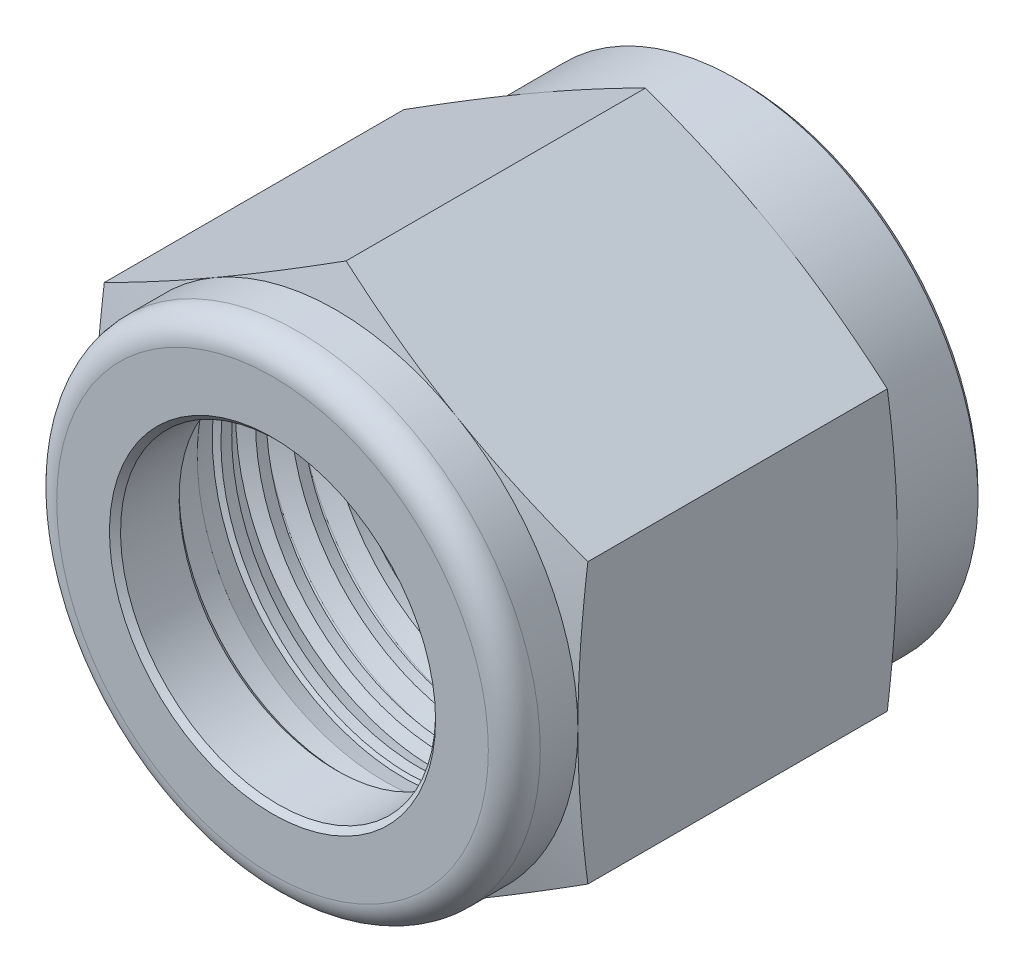
from build123d import *

# Parameters (mm, degrees)
BOSS_EXTRUDE1_DEPTH = 21.5646
FILLET1_R           = 1.1938
CHAMFER1_SIZE       = 0.254
CHAMFER2_SIZE       = 0.254
CUT_SWEEP1_PITCH    = 1.5875


with BuildPart() as part:
    # Sketch1 → Boss-Extrude1 (new body)
    with BuildSketch(Plane.XY):
        Polygon((0, 12.831609733), (-11.1125, 6.415804866), (-11.1125, -6.415804866), (0, -12.831609733), (11.1125, -6.415804866), (11.1125, 6.415804866), align=None)
    extrude(amount=BOSS_EXTRUDE1_DEPTH)

    # Sketch2 → Cut-Revolve1 (revolve, cut)
    with BuildSketch(Plane(origin=(0, 0, 0), x_dir=(0, 0, -1), z_dir=(1, 0, 0))):
        Polygon((-21.5646, 14.550719465), (-21.5646, 11.1125), (-18.6436, 11.1125), (-18.182965935, 12.831609733), (-4.423034065, 12.831609733), (-3.9624, 11.1125), (0, 11.1125), (0, 14.550719465), align=None)
        with BuildLine():
            Line((-21.5646, 7.239), (-21.5646, 0))
            Line((-21.5646, 0), (0, 0))
            Line((0, 0), (0, 8.751666378))
            Line((0, 8.751666378), (-18.1102, 8.751666378))
            ThreePointArc((-18.1102, 8.751666378), (-18.289805122, 8.6772715), (-18.3642, 8.497666378))
            Line((-18.3642, 8.497666378), (-18.3642, 7.239))
            Line((-18.3642, 7.239), (-21.5646, 7.239))
        make_face()
    revolve(axis=Axis((0, 0, 0), (0, 0, 1)), mode=Mode.SUBTRACT)

    # Fillet1
    fillet1_edges = [part.edges().sort_by_distance(p)[0] for p in [
        (0, -11.1125, 21.5646),
    ]]
    fillet(fillet1_edges, radius=FILLET1_R)

    # Chamfer1
    chamfer1_edges = [part.edges().sort_by_distance(p)[0] for p in [
        (0, -11.1125, 0),
    ]]
    chamfer(chamfer1_edges, length=CHAMFER1_SIZE)

    # Chamfer2
    chamfer2_edges = [part.edges().sort_by_distance(p)[0] for p in [
        (0, -7.239, 21.5646),
        (0, -7.239, 18.3642),
    ]]
    chamfer(chamfer2_edges, length=CHAMFER2_SIZE)

    # Cut-Sweep1: the profile of Sketch4 screwed along a right-hand helix of 11.352 turns, 8 arcs to a turn; built about Z, then put on its axis
    cut_sweep1_z = Axis((0, 0, 0), (0, 0, 1))
    cut_sweep1_corners = [(9.525, 0, -0.446484375), (8.536851483, 0, 0.124023437), (8.536851483, 0, -1.215429687), (9.525, 0, -0.644921875), (9.582283972, 0, -0.545703125)]
    with BuildLine(mode=Mode.PRIVATE) as cut_sweep1_profile:
        Line(cut_sweep1_corners[0], cut_sweep1_corners[1])
        Line(cut_sweep1_corners[1], cut_sweep1_corners[2])
        Line(cut_sweep1_corners[2], cut_sweep1_corners[3])
        ThreePointArc((9.525, 0, -0.644921875), (9.566934778, 0, -0.602987097), (9.582283972, 0, -0.545703125))
        ThreePointArc((9.582283972, 0, -0.545703125), (9.566934778, 0, -0.488419153), (9.525, 0, -0.446484375))
    cut_sweep1_cap = Face(cut_sweep1_profile.wire())
    cut_sweep1_arcs = [((9.525, 0, -0.644921875), (9.582283972, 0, -0.611848958), (9.582283972, 0, -0.545703125), (1, 0.8660254037844388, 1)), ((9.582283972, 0, -0.545703125), (9.582283972, 0, -0.479557292), (9.525, 0, -0.446484375), (1, 0.8660254037844388, 1))]  # start, shoulder, end, weights
    cut_sweep1_turn_angles = [0, 22.5, 45, 67.5, 90, 112.5, 135, 157.5, 180, 202.5, 225, 247.5, 270, 292.5, 315, 337.5, 360]
    cut_sweep1_turn_weights = [1, 0.9238795325112867, 1, 0.9238795325112867, 1, 0.9238795325112867, 1, 0.9238795325112867, 1, 0.9238795325112867, 1, 0.9238795325112867, 1, 0.9238795325112867, 1, 0.9238795325112867, 1]
    cut_sweep1_turn_rails = [Edge.make_bspline([Vector(p[0], p[1], 0).rotate(cut_sweep1_z, cut_sweep1_turn_angles[k]) / cut_sweep1_turn_weights[k] + Vector(0, 0, p[2] + CUT_SWEEP1_PITCH * cut_sweep1_turn_angles[k] / 360) for k in range(17)], [0, 0, 0, 1, 1, 2, 2, 3, 3, 4, 4, 5, 5, 6, 6, 7, 7, 8, 8, 8], 2, cut_sweep1_turn_weights) for p in cut_sweep1_corners]
    cut_sweep1_turn_sides = [*[Face.make_surface_from_curves(cut_sweep1_turn_rails[p[0]], cut_sweep1_turn_rails[p[1]]) for p in [(0, 1), (1, 2), (2, 3)]], *[Face.make_bezier_surface([[Vector(p[j][0], p[j][1], 0).rotate(cut_sweep1_z, cut_sweep1_turn_angles[2 * i + k]) / cut_sweep1_turn_weights[2 * i + k] + Vector(0, 0, p[j][2] + CUT_SWEEP1_PITCH * cut_sweep1_turn_angles[2 * i + k] / 360) for k in range(3)] for j in range(3)], [[p[3][j] * cut_sweep1_turn_weights[2 * i + k] for k in range(3)] for j in range(3)]) for p in cut_sweep1_arcs for i in range(8)]]
    cut_sweep1_last_angles = [3960, 3982.5, 4005, 4027.5, 4050, 4068.36, 4086.72]
    cut_sweep1_last_weights = [1, 0.9238795325112867, 1, 0.9238795325112867, 1, 0.9490961449902189, 1]
    cut_sweep1_last_rails = [Edge.make_bspline([Vector(p[0], p[1], 0).rotate(cut_sweep1_z, cut_sweep1_last_angles[k]) / cut_sweep1_last_weights[k] + Vector(0, 0, p[2] + CUT_SWEEP1_PITCH * cut_sweep1_last_angles[k] / 360) for k in range(7)], [0, 0, 0, 1, 1, 2, 2, 3, 3, 3], 2, cut_sweep1_last_weights) for p in cut_sweep1_corners]
    cut_sweep1_last_sides = [*[Face.make_surface_from_curves(cut_sweep1_last_rails[p[0]], cut_sweep1_last_rails[p[1]]) for p in [(0, 1), (1, 2), (2, 3)]], *[Face.make_bezier_surface([[Vector(p[j][0], p[j][1], 0).rotate(cut_sweep1_z, cut_sweep1_last_angles[2 * i + k]) / cut_sweep1_last_weights[2 * i + k] + Vector(0, 0, p[j][2] + CUT_SWEEP1_PITCH * cut_sweep1_last_angles[2 * i + k] / 360) for k in range(3)] for j in range(3)], [[p[3][j] * cut_sweep1_last_weights[2 * i + k] for k in range(3)] for j in range(3)]) for p in cut_sweep1_arcs for i in range(3)]]
    cut_sweep1 = Plane(origin=(0, 0, 0), x_dir=(0, 1, 0), z_dir=(0, 0, 1)) * Solid(Shell([*[p.moved(Location((0, 0, CUT_SWEEP1_PITCH * i))) for i in range(11) for p in cut_sweep1_turn_sides], *cut_sweep1_last_sides, cut_sweep1_cap, cut_sweep1_cap.rotate(cut_sweep1_z, 4086.72).moved(Location((0, 0, CUT_SWEEP1_PITCH * 4086.72 / 360)))]))
    add(cut_sweep1, mode=Mode.SUBTRACT)

    # Cut-Extrude1 cone 1 section (through the dimple's axis) → Cut-Extrude1 (revolve, cut)
    with BuildSketch(Plane.YZ):
        Polygon((0, 0), (9.525, 0), (0, 9.525), align=None)
    revolve(axis=Axis((0, 0, 0), (0, 0, 1)), mode=Mode.SUBTRACT)

    # Sketch6 → Revolve1 (revolve)
    with BuildSketch(Plane(origin=(0, 0, 0), x_dir=(0, 0, -1), z_dir=(1, 0, 0))):
        Polygon((-18.3642, 9.696851916), (-12.2936, 9.696851916), (-16.4338, 8.751666378), (-18.3642, 8.751666378), align=None)
    revolve(axis=Axis((0, 0, 0), (0, 0, 1)))


solid = part.part
